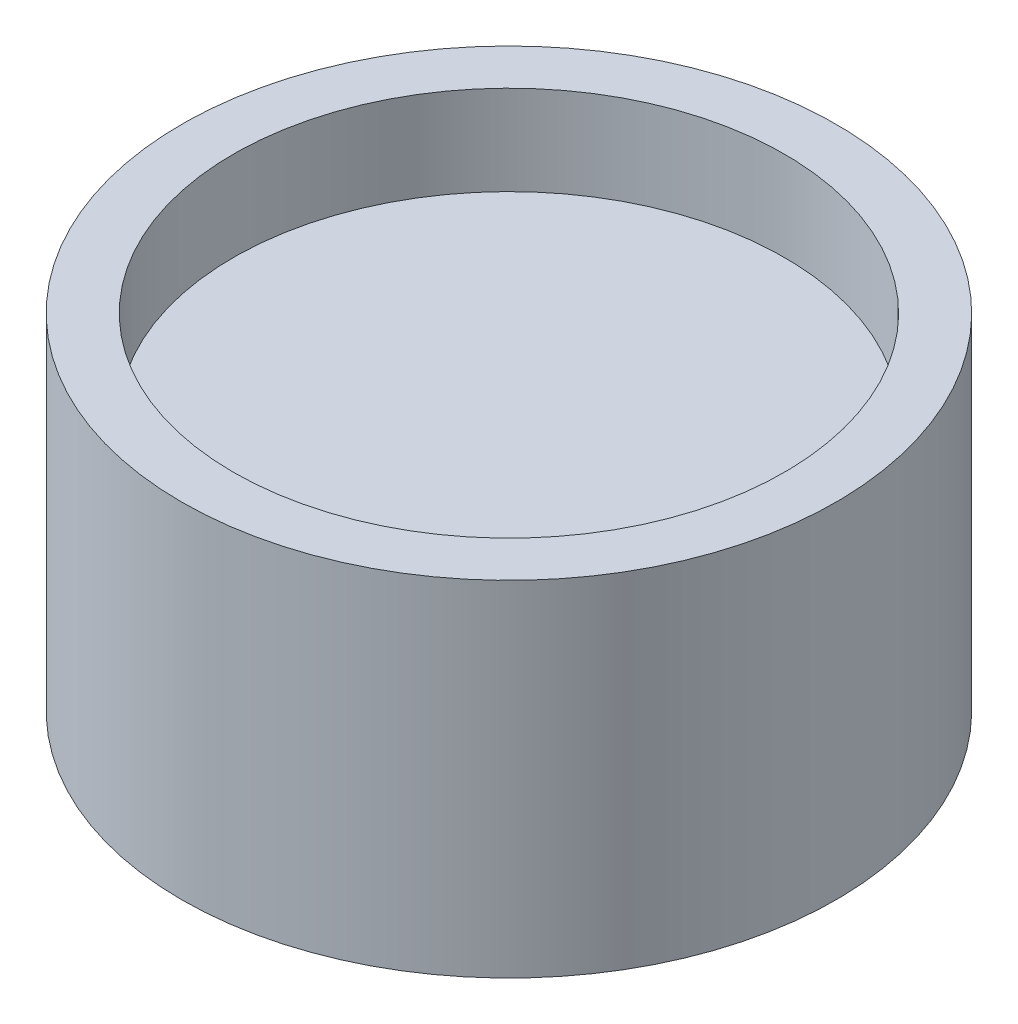
from build123d import *


with BuildPart() as part:
    # Sketch1 → Revolve1 (revolve)
    with BuildSketch(Plane.XY):
        Polygon((0, -15.24), (0, 15.24), (-50.8, 15.24), (-50.8, 31.75), (-60.325, 31.75), (-60.325, -31.75), (-50.8, -31.75), (-50.8, -15.24), align=None)
    revolve(axis=Axis((0, 31.75, 0), (0, -1, 0)))


solid = part.part
